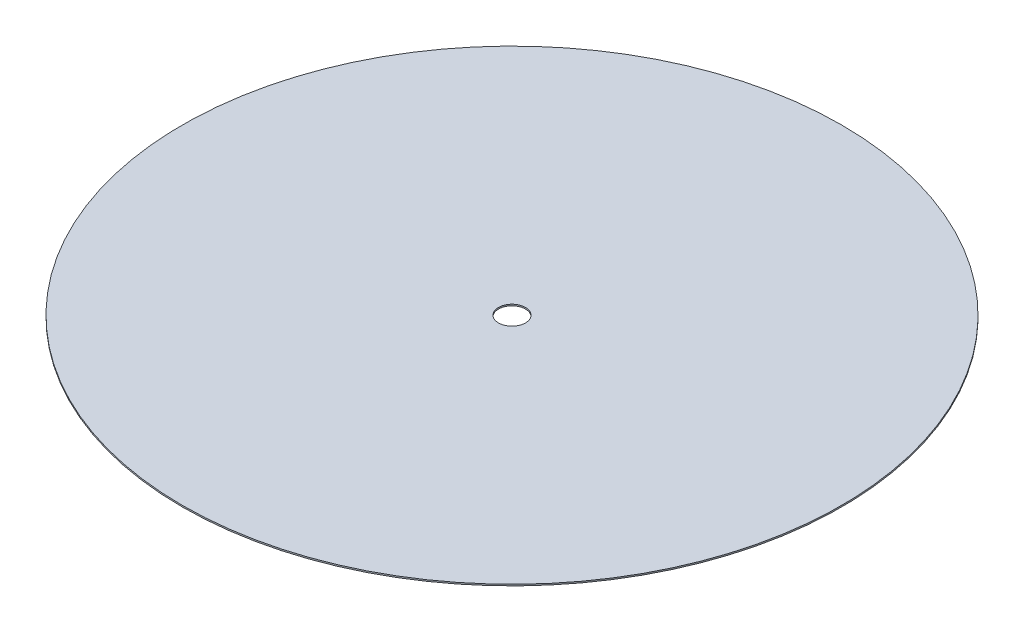
from build123d import *

# Parameters (mm, degrees)
SKETCH1_R           = 160.3375
BOSS_EXTRUDE1_DEPTH = 0.7
SKETCH2_R           = 6.55
CUT_EXTRUDE1_DEPTH  = 227.752547533


with BuildPart() as part:
    # Sketch1 → Boss-Extrude1 (new body)
    with BuildSketch(Plane(origin=(0, 0, 0), x_dir=(1, 0, 0), z_dir=(0, 1, 0))):
        Circle(SKETCH1_R)
    extrude(amount=BOSS_EXTRUDE1_DEPTH)

    # Sketch2 → Cut-Extrude1 (cut, through all)
    with BuildSketch(Plane(origin=(0, 0.7, 0), x_dir=(1, 0, 0), z_dir=(0, 1, 0))):
        Circle(SKETCH2_R)
    extrude(amount=-CUT_EXTRUDE1_DEPTH, mode=Mode.SUBTRACT)


solid = part.part
